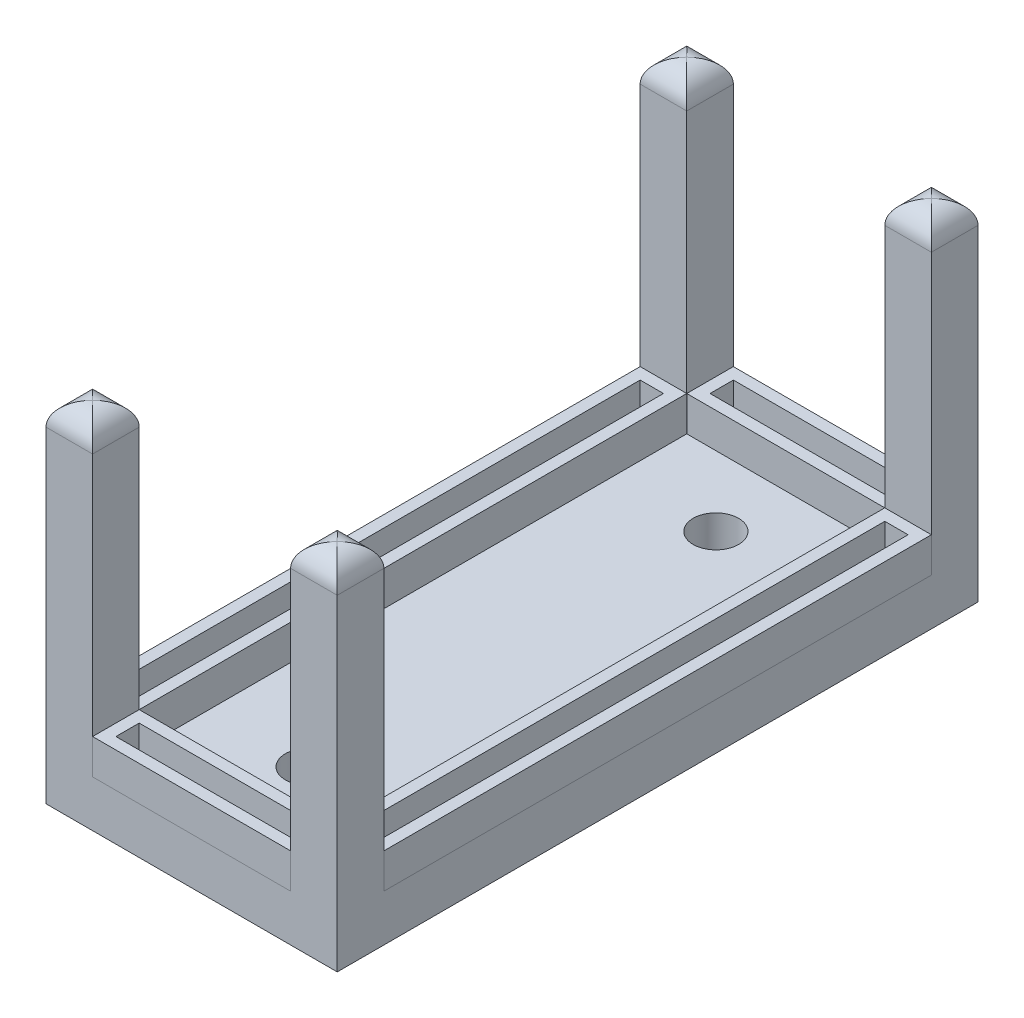
from build123d import *

# Parameters (mm, degrees)
SKETCH1_W                           = 25
SKETCH1_H                           = 30
BOSS_EXTRUDE2_DEPTH                 = 55
SHELL14_T                           = -4
SHELL15_START                       = 4
SHELL15_OUTLINE_W                   = 26
SHELL15_OUTLINE_H                   = 4
SHELL15_DEPTH                       = 17
EXTRUDE_THIN1_OUTLINE_W             = 4
EXTRUDE_THIN1_OUTLINE_H             = 47
EXTRUDE_THIN1_OUTLINE_W_2           = 2
EXTRUDE_THIN1_OUTLINE_H_2           = 45
EXTRUDE_THIN1_OUTLINE_W_3           = 17
EXTRUDE_THIN1_OUTLINE_H_3           = 4
EXTRUDE_THIN1_OUTLINE_W_4           = 15
EXTRUDE_THIN1_OUTLINE_H_4           = 2
EXTRUDE_THIN1_DEPTH                 = 3
SKETCH20_W                          = 1.95
SKETCH20_H                          = 4
F_6_0_204_DIAMETER_HOLE2_AT_2_COUNT = 2
F_6_0_204_DIAMETER_HOLE2_AT_2_PITCH = 35
FILLET1_R                           = 2


# Read off the part's stored shape, not the designer's step: Shell15, Extrude-Thin1
with BuildPart() as part:
    # Sketch1 → Boss-Extrude2 (new body)
    with BuildSketch(Plane.XY):
        with Locations((12.5, 15)):
            Rectangle(SKETCH1_W, SKETCH1_H)
    extrude(amount=-BOSS_EXTRUDE2_DEPTH)

    # Shell14
    shell14_openings = [part.faces().sort_by_distance(p)[0] for p in [
        (25, 15, -27.5),
        (12.5, 30, -27.5),
        (0, 15, -27.5),
    ]]
    offset(amount=SHELL14_T, openings=shell14_openings, kind=Kind.INTERSECTION)

    # Shell15 outline → Shell15 (cut)
    with BuildSketch(Plane.YZ.offset(SHELL15_START)):
        with Locations((17, -53)):
            Rectangle(SHELL15_OUTLINE_W, SHELL15_OUTLINE_H)
        with Locations((17, -2)):
            Rectangle(SHELL15_OUTLINE_W, SHELL15_OUTLINE_H)
    extrude(amount=SHELL15_DEPTH, mode=Mode.SUBTRACT)

    # Sketch20 → #6 (0.204) Diameter Hole2 (revolve, cut)
    with BuildSketch(Plane(origin=(12.5, 4, -45), x_dir=(0, 0, 1), z_dir=(1, 0, 0))):
        with Locations((0.975, 2)):
            Rectangle(SKETCH20_W, SKETCH20_H)
    f_6_0_204_diameter_hole2 = revolve(axis=Axis((12.5, 10.35, -45), (0, -1, 0)), mode=Mode.SUBTRACT)

    # #6 (0.204) Diameter Hole2 at 2: #6 (0.204) Diameter Hole2 ×2
    with Locations(*[(0, 0, i * F_6_0_204_DIAMETER_HOLE2_AT_2_PITCH) for i in range(1, F_6_0_204_DIAMETER_HOLE2_AT_2_COUNT)]):
        add(f_6_0_204_diameter_hole2, mode=Mode.SUBTRACT)

    # Fillet1
    fillet1_edges = [part.edges().sort_by_distance(p)[0] for p in [
        (25, 30, -2),
        (0, 30, -2),
        (2, 30, -4),
        (2, 30, -51),
        (23, 30, -4),
        (23, 30, -51),
        (23, 30, 0),
        (23, 30, -55),
        (21, 30, -53),
        (4, 30, -53),
        (4, 30, -2),
        (21, 30, -2),
        (2, 30, 0),
        (25, 30, -53),
        (0, 30, -53),
        (2, 30, -55),
    ]]
    fillet(fillet1_edges, radius=FILLET1_R - 0.0001)  # a hair under: the kernel refuses the full size


with BuildPart() as body_2:
    # Extrude-Thin1 outline → Extrude-Thin1 (new body)
    # profile 1 of 4: a face of its own
    with BuildSketch(Plane(origin=(0, 4, 0), x_dir=(1, 0, 0), z_dir=(0, 1, 0))):
        with Locations((23, 27.5)):
            Rectangle(EXTRUDE_THIN1_OUTLINE_W, EXTRUDE_THIN1_OUTLINE_H)
        with Locations((23, 27.5)):
            Rectangle(EXTRUDE_THIN1_OUTLINE_W_2, EXTRUDE_THIN1_OUTLINE_H_2, mode=Mode.SUBTRACT)
    # profile 2 of 4: a face of its own
    with BuildSketch(Plane(origin=(0, 4, 0), x_dir=(1, 0, 0), z_dir=(0, 1, 0))):
        with Locations((12.5, 53)):
            Rectangle(EXTRUDE_THIN1_OUTLINE_W_3, EXTRUDE_THIN1_OUTLINE_H_3)
        with Locations((12.5, 53)):
            Rectangle(EXTRUDE_THIN1_OUTLINE_W_4, EXTRUDE_THIN1_OUTLINE_H_4, mode=Mode.SUBTRACT)
    # profile 3 of 4: a face of its own
    with BuildSketch(Plane(origin=(0, 4, 0), x_dir=(1, 0, 0), z_dir=(0, 1, 0))):
        with Locations((2, 27.5)):
            Rectangle(EXTRUDE_THIN1_OUTLINE_W, EXTRUDE_THIN1_OUTLINE_H)
        with Locations((2, 27.5)):
            Rectangle(EXTRUDE_THIN1_OUTLINE_W_2, EXTRUDE_THIN1_OUTLINE_H_2, mode=Mode.SUBTRACT)
    # profile 4 of 4: a face of its own
    with BuildSketch(Plane(origin=(0, 4, 0), x_dir=(1, 0, 0), z_dir=(0, 1, 0))):
        with Locations((12.5, 2)):
            Rectangle(EXTRUDE_THIN1_OUTLINE_W_3, EXTRUDE_THIN1_OUTLINE_H_3)
        with Locations((12.5, 2)):
            Rectangle(EXTRUDE_THIN1_OUTLINE_W_4, EXTRUDE_THIN1_OUTLINE_H_4, mode=Mode.SUBTRACT)
    extrude(amount=EXTRUDE_THIN1_DEPTH)


solid = Compound([part.part, body_2.part])
